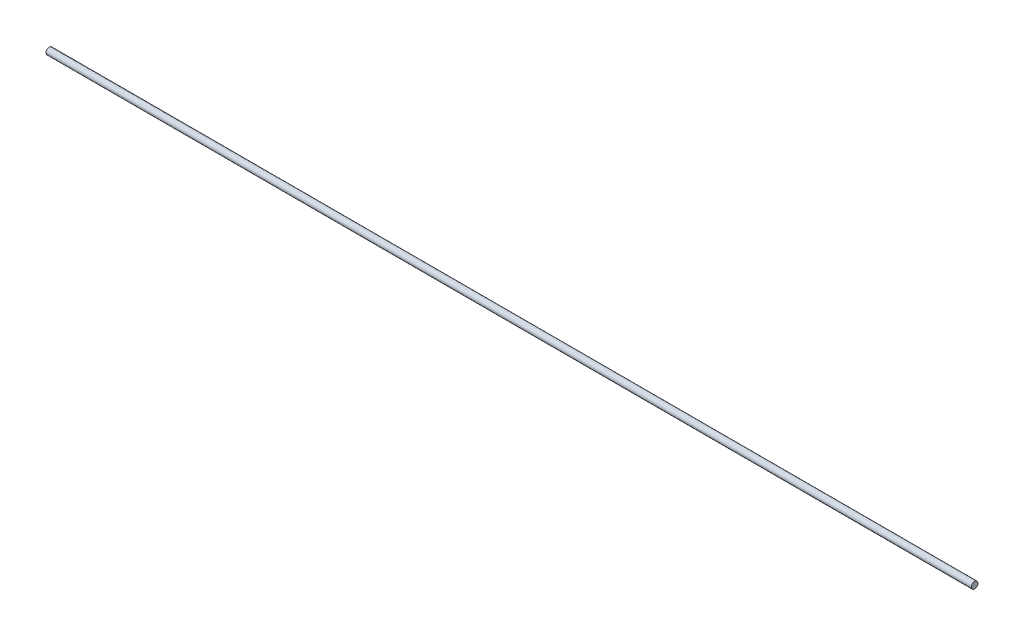
from build123d import *

# Parameters (mm, degrees)
SKETCH1_R           = 1
BOSS_EXTRUDE1_DEPTH = 280


with BuildPart() as part:
    # Sketch1 → Boss-Extrude1 (new body)
    with BuildSketch(Plane(origin=(0, 0, 0), x_dir=(0, 0, -1), z_dir=(1, 0, 0))):
        Circle(SKETCH1_R)
    extrude(amount=BOSS_EXTRUDE1_DEPTH)


solid = part.part
